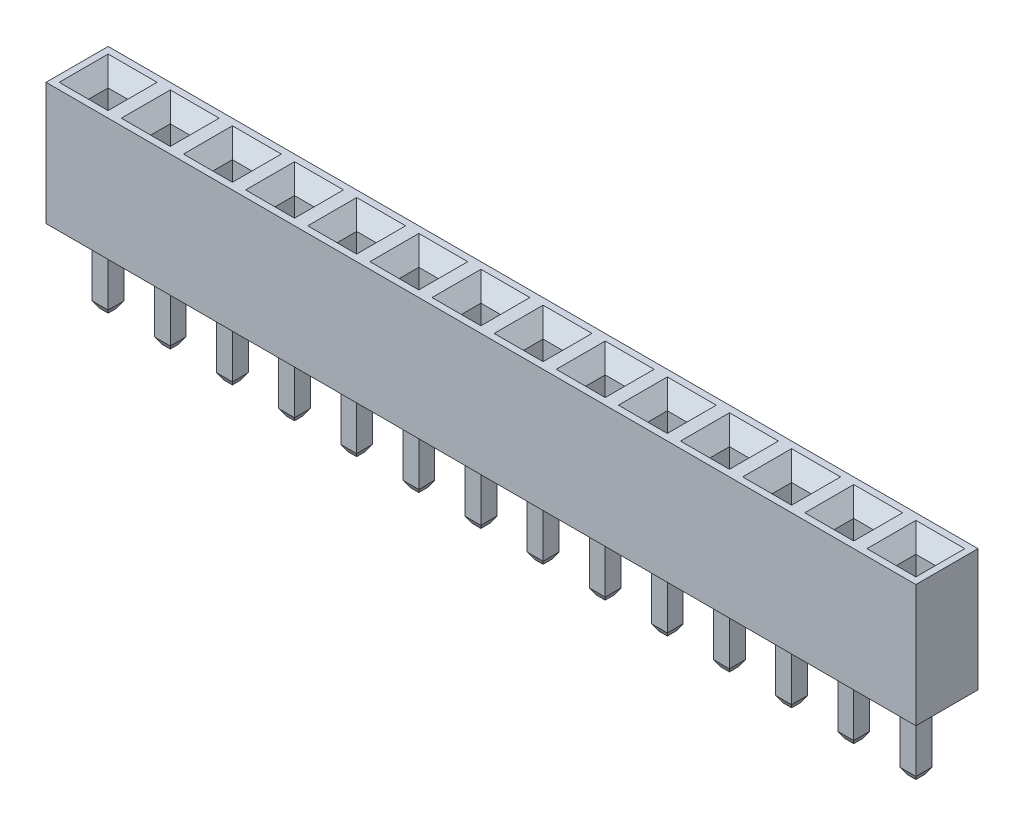
from build123d import *

# Parameters (mm, degrees)
SKETCH1_W                   = 2.54
SKETCH1_H                   = 2.54
BOSS_EXTRUDE1_DEPTH         = 5
SKETCH2_W                   = 0.65
SKETCH2_H                   = 0.65
BOSS_EXTRUDE2_DEPTH         = 3
CHAMFER1_SIZE               = 0.15
CHAMFER1_SIZE2              = 0.259807621
SKETCH3_W                   = 0.8
SKETCH3_H                   = 0.8
CUT_EXTRUDE1_DEPTH          = 3
CHAMFER2_SIZE               = 0.6
LPATTERN1_COUNT             = 14
LPATTERN1_PITCH             = 2.54
CHAMFER1_OF_LPATTERN1_SIZE2 = 0.15
CHAMFER1_OF_LPATTERN1_SIZE  = 0.259807621
CHAMFER2_OF_LPATTERN1_SIZE  = 0.6


with BuildPart() as part:
    # Sketch1 → Boss-Extrude1 (new body)
    with BuildSketch(Plane(origin=(0, 0, 0), x_dir=(1, 0, 0), z_dir=(0, 1, 0))):
        Rectangle(SKETCH1_W, SKETCH1_H)
    boss_extrude1 = extrude(amount=BOSS_EXTRUDE1_DEPTH)

    # Sketch2 → Boss-Extrude2 (add)
    with BuildSketch(Plane.XZ):
        Rectangle(SKETCH2_W, SKETCH2_H)
    boss_extrude2 = extrude(amount=BOSS_EXTRUDE2_DEPTH)

    # Chamfer1
    chamfer1_edges = [part.edges().sort_by_distance(p)[0] for p in [
        (0.325, -3, 0),
        (0, -3, 0.325),
        (-0.325, -3, 0),
        (0, -3, -0.325),
    ]]
    chamfer1_side = [part.faces().sort_by_distance(p)[0] for p in [
        (0, -3, 0),
    ]]
    chamfer(chamfer1_edges, length=CHAMFER1_SIZE, length2=CHAMFER1_SIZE2, reference=chamfer1_side[0])

    # Sketch3 → Cut-Extrude1 (cut)
    with BuildSketch(Plane(origin=(0, 5, 0), x_dir=(1, 0, 0), z_dir=(0, 1, 0))):
        Rectangle(SKETCH3_W, SKETCH3_H)
    cut_extrude1 = extrude(amount=-CUT_EXTRUDE1_DEPTH, mode=Mode.SUBTRACT)

    # Chamfer2
    chamfer2_edges = [part.edges().sort_by_distance(p)[0] for p in [
        (0.4, 5, 0),
        (0, 5, -0.4),
        (-0.4, 5, 0),
        (0, 5, 0.4),
    ]]
    chamfer(chamfer2_edges, length=CHAMFER2_SIZE)

    # LPattern1: Boss-Extrude1, Boss-Extrude2, Cut-Extrude1 ×14
    with Locations(*[(i * LPATTERN1_PITCH, 0, 0) for i in range(1, LPATTERN1_COUNT)]):
        add(boss_extrude1)
        add(boss_extrude2)
        add(cut_extrude1, mode=Mode.SUBTRACT)

    # Chamfer1 of LPattern1
    chamfer1_of_lpattern1_edges = [part.edges().sort_by_distance(p)[0] for p in [
        (2.865, -3, 0),
        (2.54, -3, 0.325),
        (2.215, -3, 0),
        (2.54, -3, -0.325),
        (5.405, -3, 0),
        (5.08, -3, 0.325),
        (4.755, -3, 0),
        (5.08, -3, -0.325),
        (7.945, -3, 0),
        (7.62, -3, 0.325),
        (7.295, -3, 0),
        (7.62, -3, -0.325),
        (10.485, -3, 0),
        (10.16, -3, 0.325),
        (9.835, -3, 0),
        (10.16, -3, -0.325),
        (13.025, -3, 0),
        (12.7, -3, 0.325),
        (12.375, -3, 0),
        (12.7, -3, -0.325),
        (15.565, -3, 0),
        (15.24, -3, 0.325),
        (14.915, -3, 0),
        (15.24, -3, -0.325),
        (18.105, -3, 0),
        (17.78, -3, 0.325),
        (17.455, -3, 0),
        (17.78, -3, -0.325),
        (20.645, -3, 0),
        (20.32, -3, 0.325),
        (19.995, -3, 0),
        (20.32, -3, -0.325),
        (23.185, -3, 0),
        (22.86, -3, 0.325),
        (22.535, -3, 0),
        (22.86, -3, -0.325),
        (25.725, -3, 0),
        (25.4, -3, 0.325),
        (25.075, -3, 0),
        (25.4, -3, -0.325),
        (28.265, -3, 0),
        (27.94, -3, 0.325),
        (27.615, -3, 0),
        (27.94, -3, -0.325),
        (30.805, -3, 0),
        (30.48, -3, 0.325),
        (30.155, -3, 0),
        (30.48, -3, -0.325),
        (33.345, -3, 0),
        (33.02, -3, 0.325),
        (32.695, -3, 0),
        (33.02, -3, -0.325),
    ]]
    chamfer(chamfer1_of_lpattern1_edges, length=CHAMFER1_OF_LPATTERN1_SIZE, length2=CHAMFER1_OF_LPATTERN1_SIZE2)

    # Chamfer2 of LPattern1
    chamfer2_of_lpattern1_edges = [part.edges().sort_by_distance(p)[0] for p in [
        (2.94, 5, 0),
        (2.54, 5, -0.4),
        (2.14, 5, 0),
        (2.54, 5, 0.4),
        (5.48, 5, 0),
        (5.08, 5, -0.4),
        (4.68, 5, 0),
        (5.08, 5, 0.4),
        (8.02, 5, 0),
        (7.62, 5, -0.4),
        (7.22, 5, 0),
        (7.62, 5, 0.4),
        (10.56, 5, 0),
        (10.16, 5, -0.4),
        (9.76, 5, 0),
        (10.16, 5, 0.4),
        (13.1, 5, 0),
        (12.7, 5, -0.4),
        (12.3, 5, 0),
        (12.7, 5, 0.4),
        (15.64, 5, 0),
        (15.24, 5, -0.4),
        (14.84, 5, 0),
        (15.24, 5, 0.4),
        (18.18, 5, 0),
        (17.78, 5, -0.4),
        (17.38, 5, 0),
        (17.78, 5, 0.4),
        (20.72, 5, 0),
        (20.32, 5, -0.4),
        (19.92, 5, 0),
        (20.32, 5, 0.4),
        (23.26, 5, 0),
        (22.86, 5, -0.4),
        (22.46, 5, 0),
        (22.86, 5, 0.4),
        (25.8, 5, 0),
        (25.4, 5, -0.4),
        (25, 5, 0),
        (25.4, 5, 0.4),
        (28.34, 5, 0),
        (27.94, 5, -0.4),
        (27.54, 5, 0),
        (27.94, 5, 0.4),
        (30.88, 5, 0),
        (30.48, 5, -0.4),
        (30.08, 5, 0),
        (30.48, 5, 0.4),
        (33.42, 5, 0),
        (33.02, 5, -0.4),
        (32.62, 5, 0),
        (33.02, 5, 0.4),
    ]]
    chamfer(chamfer2_of_lpattern1_edges, length=CHAMFER2_OF_LPATTERN1_SIZE)


solid = part.part
